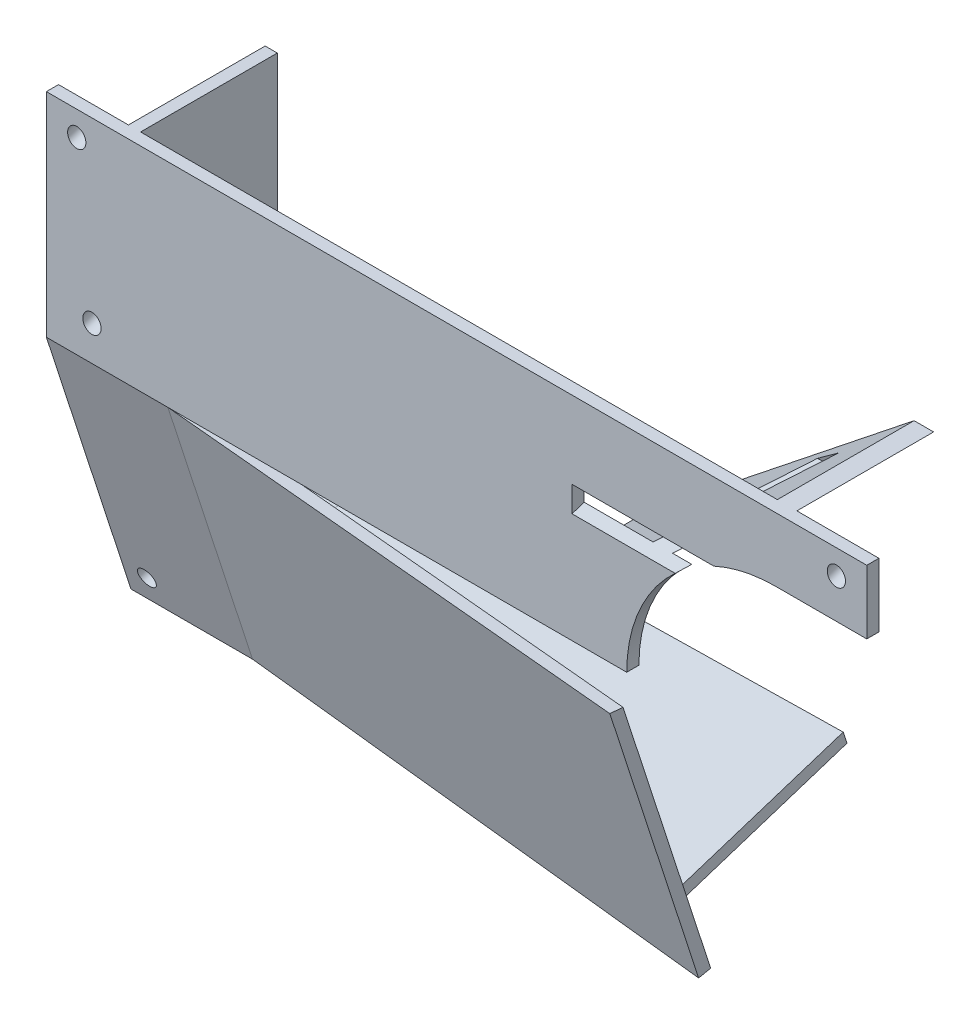
from build123d import *

# Parameters (mm, degrees)
SKETCH1_W               = 270
SKETCH1_H               = 70
BOSS_EXTRUDE1_DEPTH     = 4
BOSS_EXTRUDE4_DEPTH     = 70
SKETCH7_R               = 3
CUT_EXTRUDE1_DEPTH      = 304.970702227
CUT_EXTRUDE2_DEPTH      = 10
SKETCH9_W               = 4
SKETCH9_H               = 70
BOSS_EXTRUDE5_DEPTH     = 45
SKETCH10_W              = 13
SKETCH10_H              = 4
BOSS_EXTRUDE6_DEPTH     = 43
BOSS_EXTRUDE7_REACH     = 313.858
BOSS_EXTRUDE8_REACH     = 276.704
BOSS_EXTRUDE9_START     = -155.441370069
BOSS_EXTRUDE9_DEPTH     = 24.603121834
SKETCH14_R              = 3
CUT_EXTRUDE3_DEPTH      = 4
CUT_EXTRUDE4_REACH      = 322.045
SKETCH15_W              = 7
SKETCH15_H              = 3.80460454
CUT_EXTRUDE5_DEPTH      = 10
CUT_EXTRUDE5_DEPTH_BACK = 304.645223857
CUT_EXTRUDE6_DEPTH      = 70


# Read off the part's stored shape, not the designer's step: Boss-Extrude9
with BuildPart() as part:
    # Sketch1 → Boss-Extrude1 (new body)
    with BuildSketch(Plane.XY):
        with Locations((135, -35)):
            Rectangle(SKETCH1_W, SKETCH1_H)
    extrude(amount=BOSS_EXTRUDE1_DEPTH)


with BuildPart() as body_2:
    # Mirror1: mirrored copy
    add(part.part.mirror(Plane(origin=(135, 0, 0), x_dir=(0, 0, 1), z_dir=(1, 0, 0))))


with BuildPart() as part_1:
    add(part.part)

    add(body_2.part)  # Boss-Extrude4 merges body 2
    # Sketch2 → Boss-Extrude4 (add, along a direction that is not the sketch's normal)
    with BuildSketch(Plane.XZ.offset(70)):
        Polygon((200.361038291, 14.593997741), (40, 0), (0, 0), (0, 4), (40, 4), (200, 18.561140682), align=None)
    extrude(amount=BOSS_EXTRUDE4_DEPTH, dir=(0, -0.9510565162951534, -0.30901699437494823))

    # Sketch7 → Cut-Extrude1 (cut, through all)
    with BuildSketch(Plane(origin=(0, -15.671129003, 48.230775743), x_dir=(-1, 0, 0), z_dir=(0, 0.3090169943749448, -0.9510565162951545))):
        with Locations((-8, -146.441370146)):
            Circle(SKETCH7_R)
        with Locations(Location((-15, -54.441370146, 0), (0, 0, 270))):
            Circle(SKETCH7_R)
        with Locations(Location((-255, -54.441370146, 0), (0, 0, 270))):
            Circle(SKETCH7_R)
        with Locations((-262, -146.441370146)):
            Circle(SKETCH7_R)
        with Locations(Location((-10, -6.441370146, 0), (0, 0, 270))):
            Circle(SKETCH7_R)
        with Locations(Location((-260, -6.441370146, 0), (0, 0, 270))):
            Circle(SKETCH7_R)
    extrude(amount=CUT_EXTRUDE1_DEPTH, mode=Mode.SUBTRACT)

    # Sketch8 → Cut-Extrude2 (cut)
    with BuildSketch(Plane(origin=(0, 0, 0), x_dir=(-1, 0, 0), z_dir=(0, 0, -1))):
        with BuildLine():
            Line((-270, -70), (-270, -21))
            Line((-270, -21), (-240, -21))
            ThreePointArc((-240, -21), (-205.351767722, -35.351767722), (-191, -70))
            Line((-191, -70), (-270, -70))
        make_face()
    extrude(amount=-CUT_EXTRUDE2_DEPTH, mode=Mode.SUBTRACT)

    # Sketch9 → Boss-Extrude5 (add)
    with BuildSketch(Plane(origin=(0, 0, 0), x_dir=(-1, 0, 0), z_dir=(0, 0, -1))):
        Polygon((-243, 0), (-155, -70), (-148.574540436, -70), (-152.509905737, -66.869595783), (-236.574540436, 0), align=None)
        with Locations((-25, -35)):
            Rectangle(SKETCH9_W, SKETCH9_H)
    extrude(amount=BOSS_EXTRUDE5_DEPTH)

    # Sketch10 → Boss-Extrude6 (add)
    with BuildSketch(Plane(origin=(0, -6.684405197, 20.57248383), x_dir=(-1, 0, 0), z_dir=(0, 0.3090169943749482, -0.9510565162951534))):
        with Locations((-33.5, -134.573956141)):
            Rectangle(SKETCH10_W, SKETCH10_H)
        Polygon((-23, -66.573956141), (-27, -66.573956141), (-27, -132.573956141), (-27, -136.573956141), (-23, -136.573956141), align=None)
    extrude(amount=BOSS_EXTRUDE6_DEPTH)

    # Boss-Extrude7: up to this plane
    boss_extrude7_end = Plane(origin=(0, 6.603325561, -20.32294637), z_dir=(0, 0.30901699437494823, -0.9510565162951534))
    # Sketch11 → Boss-Extrude7 (add, up to the surface)
    with BuildSketch(Plane(origin=(-1.560893066, -5.572804076, 17.151327361), x_dir=(-0.9962752106554099, 0.026646699794247903, -0.08201010927680777), z_dir=(0.08623053191021567, 0.30786597116700337, -0.947514031117154)), mode=Mode.PRIVATE) as boss_extrude7_sk1:
        Polygon((-41.716277412, -132.573956141), (-202.676859965, -128.064162823), (-202.676859965, -132.064162823), (-41.716277412, -136.573956141), align=None)
    boss_extrude7_tool1 = split(extrude(boss_extrude7_sk1.sketch, amount=BOSS_EXTRUDE7_REACH, mode=Mode.PRIVATE), bisect_by=boss_extrude7_end, keep=Keep.BOTH, mode=Mode.PRIVATE)
    add(boss_extrude7_tool1.solids().sort_by_distance((120.180519, -134.671843, -13.716157))[0])

    # Boss-Extrude8: up to this face of the body (flat: up to its plane)
    boss_extrude8_end = Plane(part_1.part.faces().sort_by_distance((41.860887851, -128.027977729, -41.460870718))[0])
    # Sketch12 → Boss-Extrude8 (add, up to the picked face)
    with BuildSketch(Plane(origin=(40, 0, 0), x_dir=(0, 0, -1), z_dir=(1, 0, 0)), mode=Mode.PRIVATE) as boss_extrude8_sk1:
        Polygon((20.395121629, -132.769730075), (21.631189606, -136.573956141), (62.526619807, -123.286225383), (61.290551829, -119.481999317), align=None)
    boss_extrude8_tool1 = split(extrude(boss_extrude8_sk1.sketch, amount=BOSS_EXTRUDE8_REACH, mode=Mode.PRIVATE), bisect_by=boss_extrude8_end, keep=Keep.BOTH, mode=Mode.PRIVATE)
    add(boss_extrude8_tool1.solids().sort_by(Axis((40, -128.027978, -41.460871), (1, 0, 0)))[0])

    # Boss-Extrude9 outline → Boss-Extrude9 (add)
    with BuildSketch(Plane(origin=(0, 0, 0), x_dir=(1, 0, 0), z_dir=(0, 0.9510565162951545, 0.3090169943749449)).offset(BOSS_EXTRUDE9_START)):
        Polygon((200.361038291, -35.510906256), (40, -21.631189606), (0, -21.631189606), (0, -25.435415671), (40, -25.435415671), (200, -39.283883402), align=None)
    extrude(amount=BOSS_EXTRUDE9_DEPTH)

    # Sketch14 → Cut-Extrude3 (cut)
    with BuildSketch(Plane(origin=(0, -6.684405197, 20.57248383), x_dir=(-1, 0, 0), z_dir=(0, 0.3090169943749481, -0.9510565162951534))):
        with Locations(Location((-8, -146.441370069, 0), (0, 0, 90))):
            Circle(SKETCH14_R)
    extrude(amount=-CUT_EXTRUDE3_DEPTH, mode=Mode.SUBTRACT)

    # Cut-Extrude4: up to this plane
    cut_extrude4_end = Plane(origin=(200.361038291, -136.573956141, -7.037191865), z_dir=(0.08623053191021565, 0.3078659711670031, -0.9475140311171542))
    # Sketch15 → Cut-Extrude4 (cut, up to the surface)
    with BuildSketch(Plane(origin=(0, 6.603325561, -20.32294637), x_dir=(-1, 0, 0), z_dir=(0, 0.3090169943749483, -0.9510565162951534)), mode=Mode.PRIVATE) as cut_extrude4_sk1:
        with Locations((-201.784144044, -130.161860553)):
            Rectangle(SKETCH15_W, SKETCH15_H)
    cut_extrude4_tool1 = split(extrude(cut_extrude4_sk1.sketch, amount=-CUT_EXTRUDE4_REACH, mode=Mode.PRIVATE), bisect_by=cut_extrude4_end, keep=Keep.BOTH, mode=Mode.PRIVATE)
    add(cut_extrude4_tool1.solids().sort_by_distance((201.784144, -117.18796, -60.545173))[0], mode=Mode.SUBTRACT)

    # Sketch16 → Cut-Extrude5 (cut, two sides: drawn at the far end of the back side and taken through both)
    with BuildSketch(Plane(origin=(0, -125.600482622, -40.81007066), x_dir=(1, 0, 0), z_dir=(0, 0.9510565162951534, 0.3090169943749483)).offset(-CUT_EXTRUDE5_DEPTH_BACK)):
        Polygon((205.284144044, 21.368810394), (198.284144044, 21.368810394), (198.284144044, -35.331144988), (200.361038291, -35.510906256), align=None)
    extrude(amount=CUT_EXTRUDE5_DEPTH + CUT_EXTRUDE5_DEPTH_BACK, mode=Mode.SUBTRACT)

    # Sketch17 → Cut-Extrude6 (cut)
    with BuildSketch(Plane(origin=(243, 0, 0), x_dir=(0, 0, -1), z_dir=(1, 0, 0))):
        Polygon((-13.772265004, -28.596864407), (35.94568304, -12.442523831), (38.417818995, -20.050975962), (-11.300129049, -36.205316538), align=None)
    extrude(amount=-CUT_EXTRUDE6_DEPTH, mode=Mode.SUBTRACT)


solid = part_1.part
